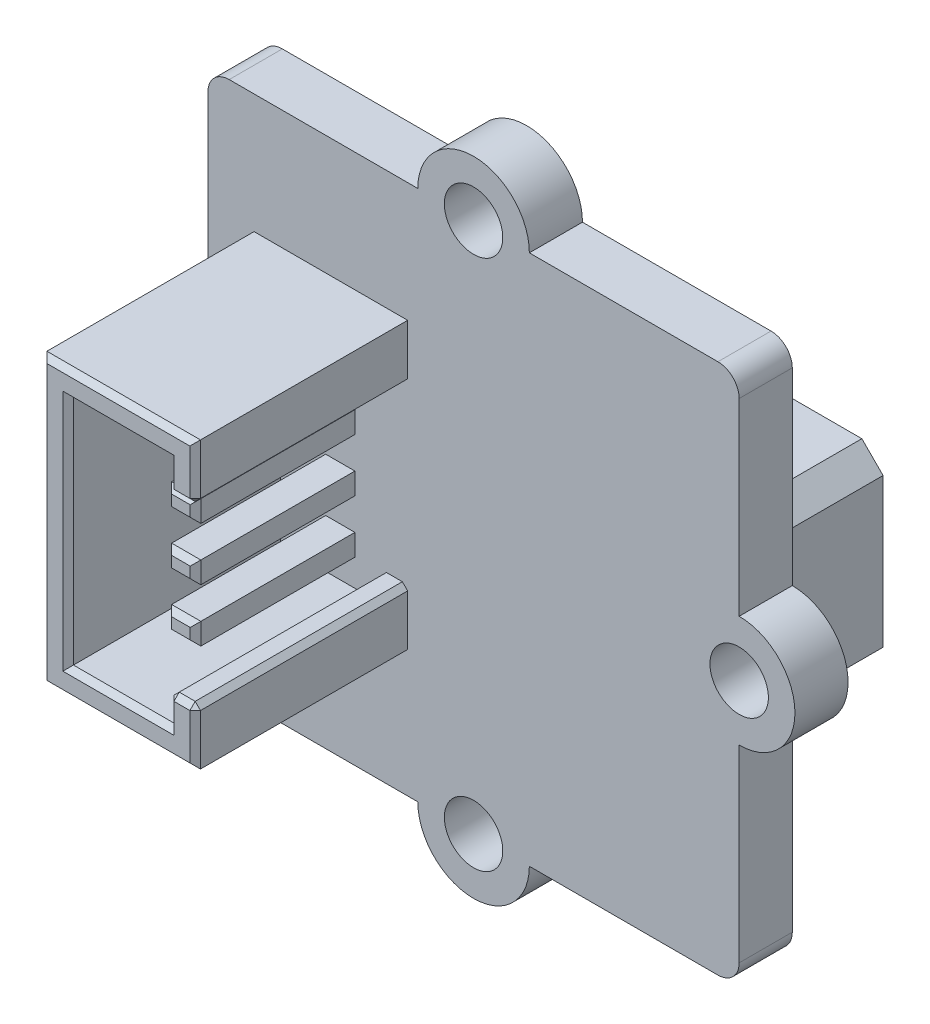
from build123d import *

# Parameters (mm, degrees)
BOSS_EXTRUDE1_DEPTH   = 2
BOSS_EXTRUDE2_DEPTH   = 8
SKETCH3_W             = 1.099637712
SKETCH3_H             = 0.808368405
BOSS_EXTRUDE3_DEPTH   = 6
SKETCH4_W             = 1.099637712
SKETCH4_H             = 0.808368405
BOSS_EXTRUDE4_DEPTH   = 6
SKETCH5_W             = 1.099637712
SKETCH5_H             = 0.808368405
BOSS_EXTRUDE5_DEPTH   = 6
SKETCH6_W             = 1.099637712
SKETCH6_H             = 0.808368405
BOSS_EXTRUDE6_DEPTH   = 6
SKETCH7_W             = 4.9
SKETCH7_H             = 6.4
BOSS_EXTRUDE7_DEPTH   = 5
F_1_CLEARANCE_HOLE1_D = 2.20000068
CHAMFER1_SIZE         = 0.2
CHAMFER2_SIZE         = 0.8
FILLET1_R             = 0.8


# Read off the part's stored shape, not the designer's step: Cut-Extrude1, Cut-Extrude2
with BuildPart() as part:
    # Sketch1 → Boss-Extrude1 (new body)
    with BuildSketch(Plane(origin=(0, 0, -2), x_dir=(-1, 0, 0), z_dir=(0, 0, -1))):
        with BuildLine():
            Line((-1.910632622, 9.092570703), (-9.810632622, 9.092570703))
            Line((-9.810632622, 9.092570703), (-9.810632622, 1.192570703))
            ThreePointArc((-9.810632622, 1.192570703), (-11.910632622, -0.907429297), (-9.810632622, -3.007429297))
            Line((-9.810632622, -3.007429297), (-9.810632622, -10.907429297))
            Line((-9.810632622, -10.907429297), (-1.910632622, -10.907429297))
            ThreePointArc((-1.910632622, -10.907429297), (0.189367378, -13.007429297), (2.289367378, -10.907429297))
            Line((2.289367378, -10.907429297), (10.189367378, -10.907429297))
            Line((10.189367378, -10.907429297), (10.189367378, -3.007429297))
            ThreePointArc((10.189367378, -3.007429297), (12.289367378, -0.907429297), (10.189367378, 1.192570703))
            Line((10.189367378, 1.192570703), (10.189367378, 9.092570703))
            Line((10.189367378, 9.092570703), (2.289367378, 9.092570703))
            ThreePointArc((2.289367378, 9.092570703), (0.189367378, 11.192570703), (-1.910632622, 9.092570703))
        make_face()
    extrude(amount=-BOSS_EXTRUDE1_DEPTH)

    # Sketch2 → Boss-Extrude2 (add)
    with BuildSketch(Plane.XY):
        Polygon((-2.670547611, -4.020890836), (-2.670547611, -6.129443348), (-8.453284272, -6.129443348), (-8.453284272, 4.602710154), (-2.670547611, 4.602710154), (-2.670547611, 2.494157643), (-3.670547611, 2.494157643), (-3.670547611, 3.602710154), (-7.453284272, 3.602710154), (-7.453284272, -5.129443348), (-3.670547611, -5.129443348), (-3.670547611, -4.020890836), align=None)
    extrude(amount=BOSS_EXTRUDE2_DEPTH)

    # Sketch3 → Boss-Extrude3 (add)
    with BuildSketch(Plane.XY):
        with Locations((-5.206678265, -1.71002656)):
            Rectangle(SKETCH3_W, SKETCH3_H)
    extrude(amount=BOSS_EXTRUDE3_DEPTH)

    # Sketch4 → Boss-Extrude4 (add)
    with BuildSketch(Plane.XY):
        with Locations((-5.206678265, 2.28997344)):
            Rectangle(SKETCH4_W, SKETCH4_H)
    extrude(amount=BOSS_EXTRUDE4_DEPTH)

    # Sketch5 → Boss-Extrude5 (add)
    with BuildSketch(Plane.XY):
        with Locations((-5.206678265, 0.289973441)):
            Rectangle(SKETCH5_W, SKETCH5_H)
    extrude(amount=BOSS_EXTRUDE5_DEPTH)

    # Sketch6 → Boss-Extrude6 (add)
    with BuildSketch(Plane.XY):
        with Locations((-5.206678265, -3.71002656)):
            Rectangle(SKETCH6_W, SKETCH6_H)
    extrude(amount=BOSS_EXTRUDE6_DEPTH)

    # Sketch7 → Boss-Extrude7 (add)
    with BuildSketch(Plane(origin=(0, 0, -2), x_dir=(-1, 0, 0), z_dir=(0, 0, -1))):
        with Locations((-5.779682622, -0.907429297)):
            Rectangle(SKETCH7_W, SKETCH7_H)
    extrude(amount=BOSS_EXTRUDE7_DEPTH)

    # Cut-Extrude1 outline → Cut-Extrude1 (revolve, cut)
    with BuildSketch(Plane(origin=(5.83567735, -2.101434569, 0), x_dir=(1, 0, 0), z_dir=(0, -1, 0))):
        with BuildLine():
            Line((0.75, -7), (0.75, -6))
            ThreePointArc((0.75, -6), (0.530330086, -6.530330086), (0, -6.75))
            Line((0, -6.75), (0, -7))
            Line((0, -7), (0.75, -7))
        make_face()
    revolve(axis=Axis((5.83567735, -2.101434569, 0), (0, 0, 1)), mode=Mode.SUBTRACT)

    # Cut-Extrude2 outline → Cut-Extrude2 (revolve, cut)
    with BuildSketch(Plane(origin=(5.83567735, 0.898565431, 0), x_dir=(1, 0, 0), z_dir=(0, -1, 0))):
        with BuildLine():
            Line((0.75, -7), (0.75, -6))
            ThreePointArc((0.75, -6), (0.530330086, -6.530330086), (0, -6.75))
            Line((0, -6.75), (0, -7))
            Line((0, -7), (0.75, -7))
        make_face()
    revolve(axis=Axis((5.83567735, 0.898565431, 0), (0, 0, 1)), mode=Mode.SUBTRACT)

    # #1 Clearance Hole1 (through all)
    with Locations(Plane(origin=(0, 0, -2), x_dir=(-1, 0, 0), z_dir=(0, 0, -1))):
        with Locations((0.189367378, -10.907429297), (0.189367378, 9.092570703), (10.189367378, -0.907429297), (-9.810632622, -0.907429297)):
            Hole(F_1_CLEARANCE_HOLE1_D / 2)

    # Chamfer1
    chamfer1_edges = [part.edges().sort_by_distance(p)[0] for p in [
        (-5.206678265, -0.114210762, 6),
        (-4.656859409, 0.28997344, 6),
        (-5.206678265, 0.694157643, 6),
        (-5.756497121, 0.28997344, 6),
        (-5.206678265, -3.305842357, 6),
        (-5.756497121, -3.71002656, 6),
        (-5.206678265, -4.114210762, 6),
        (-4.656859409, -3.71002656, 6),
        (-2.670547611, -4.020890836, 4),
        (-3.670547611, -4.020890836, 4),
        (-3.670547611, 2.494157643, 4),
        (-2.670547611, 2.494157643, 4),
        (-3.170547611, -4.020890836, 8),
        (-3.670547611, -4.575167092, 8),
        (-5.561915941, -5.129443348, 8),
        (-7.453284272, -0.763366597, 8),
        (-5.561915941, 3.602710154, 8),
        (-3.670547611, 3.048433899, 8),
        (-3.170547611, 2.494157643, 8),
        (-2.670547611, 3.548433899, 8),
        (-5.561915941, 4.602710154, 8),
        (-8.453284272, -0.763366597, 8),
        (-5.561915941, -6.129443348, 8),
        (-2.670547611, -5.075167092, 8),
        (-4.656859409, -1.71002656, 6),
        (-5.206678265, -1.305842357, 6),
        (-5.756497121, -1.71002656, 6),
        (-5.206678265, -2.114210762, 6),
        (-4.656859409, 2.28997344, 6),
        (-5.206678265, 2.694157643, 6),
        (-5.756497121, 2.28997344, 6),
        (-5.206678265, 1.885789238, 6),
    ]]
    chamfer(chamfer1_edges, length=CHAMFER1_SIZE)

    # Chamfer2
    chamfer2_edges = [part.edges().sort_by_distance(p)[0] for p in [
        (8.229682622, 2.292570703, -4.5),
    ]]
    chamfer(chamfer2_edges, length=CHAMFER2_SIZE)

    # Fillet1
    fillet1_edges = [part.edges().sort_by_distance(p)[0] for p in [
        (-10.189367378, 9.092570703, -1),
        (-10.189367378, -10.907429297, -1),
        (9.810632622, -10.907429297, -1),
        (9.810632622, 9.092570703, -1),
    ]]
    fillet(fillet1_edges, radius=FILLET1_R)


solid = part.part
